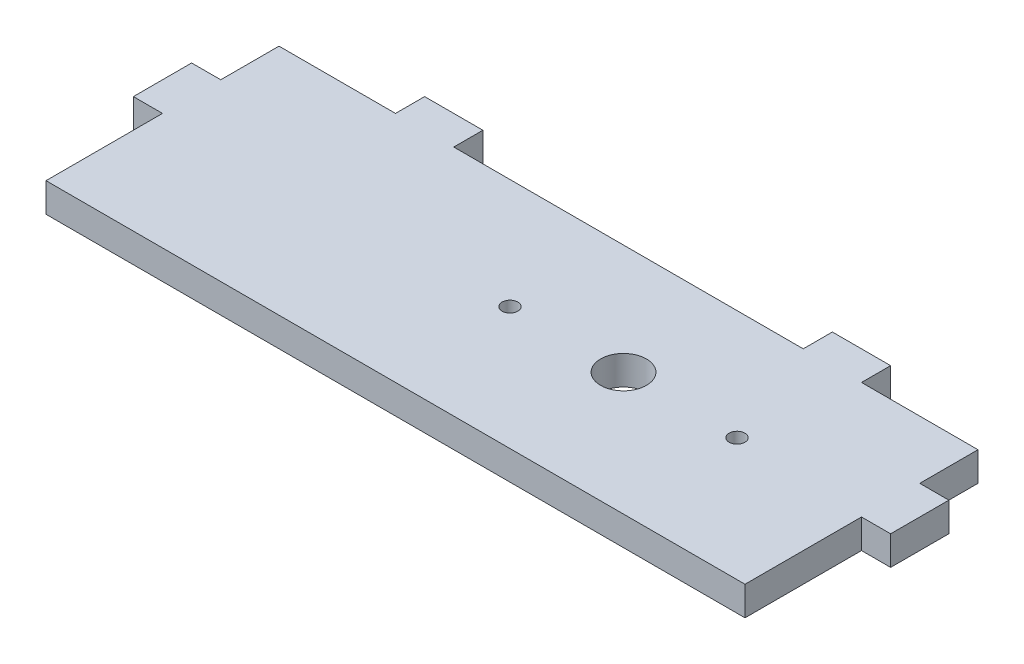
from build123d import *

# Parameters (mm, degrees)
SKETCH1_R           = 1.724999979
SKETCH1_R_2         = 5.000000033
BOSS_EXTRUDE1_DEPTH = 6.35


with BuildPart() as part:
    # Sketch1 → Boss-Extrude1 (new body)
    with BuildSketch(Plane(origin=(0, 0, 0), x_dir=(1, 0, 0), z_dir=(0, 1, 0))):
        Polygon((0, 25.4), (0, 0), (152.4, 0), (152.4, 25.4), (158.75, 25.4), (158.75, 38.1), (152.4, 38.1), (152.4, 50.8), (127, 50.8), (127, 57.15), (114.3, 57.15), (114.3, 50.8), (38.1, 50.8), (38.1, 57.15), (25.4, 57.15), (25.4, 50.8), (0, 50.8), (0, 38.1), (-6.35, 38.1), (-6.35, 25.4), align=None)
        with Locations((74.35999987, 26.799999994)):
            Circle(SKETCH1_R, mode=Mode.SUBTRACT)
        with Locations((99.1099999, 26.799999994)):
            Circle(SKETCH1_R_2, mode=Mode.SUBTRACT)
        with Locations((123.85999993, 26.799999994)):
            Circle(SKETCH1_R, mode=Mode.SUBTRACT)
    extrude(amount=BOSS_EXTRUDE1_DEPTH)


solid = part.part
